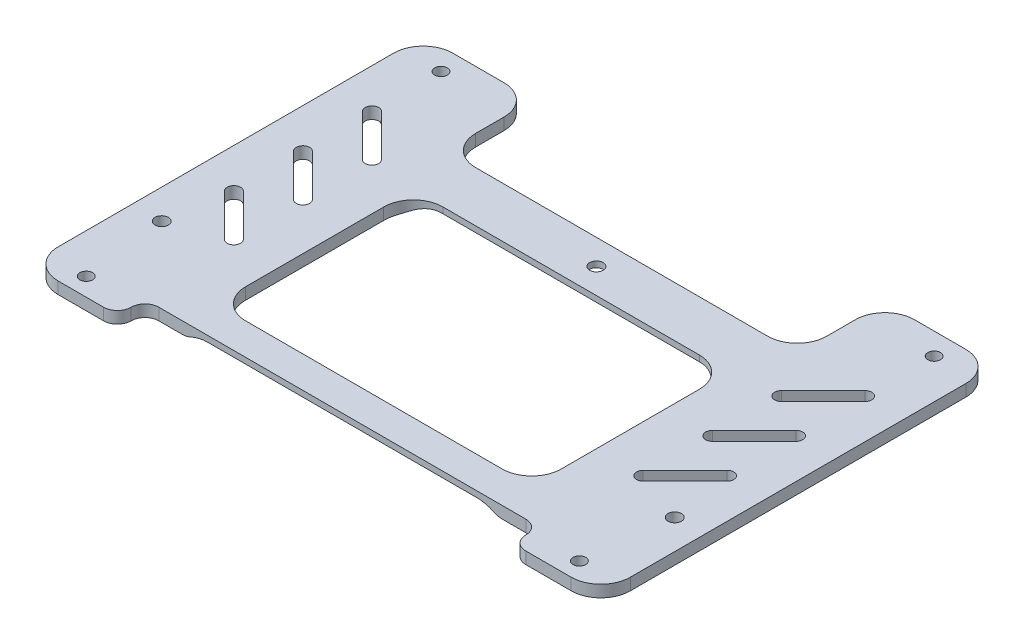
from build123d import *

# Parameters (mm, degrees)
SKETCH_1_R          = 1.7
EXTRUDE_1_DEPTH     = 3
FILLET_1_R          = 7.5
FILLET_2_R          = 3.5
CUT_EXTRUDE_5_DEPTH = 10
CUT_EXTRUDE_6_DEPTH = 10
CUT_EXTRUDE_7_DEPTH = 1.5
FILLET_START        = -35.28
FILLET_3_DEPTH      = 78.28
FILLET_4_R          = 10


with BuildPart() as part:
    # 草图1 → 凸台-拉伸1 (new body)
    with BuildSketch(Plane(origin=(0, 0, 0), x_dir=(1, 0, 0), z_dir=(0, 1, 0))):
        Polygon((-67.5, 50), (-44.5, 50), (-44.5, 27.78), (44.5, 27.78), (44.5, 50), (67.5, 50), (72.5, 50), (72.5, -50), (67.5, -50), (50, -50), (50, -43), (0, -43), (-50, -43), (-50, -50), (-67.5, -50), (-72.5, -50), (-72.5, 50), align=None)
        with Locations(Location((0, 21.39, 0), (0, 0, 270))):
            Circle(SKETCH_1_R, mode=Mode.SUBTRACT)
        with Locations(Location((65, -23.76, 0), (0, 0, 270))):
            Circle(SKETCH_1_R, mode=Mode.SUBTRACT)
        with Locations(Location((-65, -23.76, 0), (0, 0, 270))):
            Circle(SKETCH_1_R, mode=Mode.SUBTRACT)
        Polygon((-40, -10), (-40, -35), (40, -35), (40, 15), (-40, 15), align=None, mode=Mode.SUBTRACT)
    extrude(amount=EXTRUDE_1_DEPTH)

    # 圆角1
    fillet_1_edges = [part.edges().sort_by_distance(p)[0] for p in [
        (72.5, 1.5, -50),
        (72.5, 1.5, 50),
        (-72.5, 1.5, 50),
        (-72.5, 1.5, -50),
        (-44.5, 1.5, -50),
        (-44.5, 1.5, -27.78),
        (44.5, 1.5, -27.78),
        (44.5, 1.5, -50),
        (-40, 1.5, -15),
        (-40, 1.5, 35),
        (40, 1.5, 35),
        (40, 1.5, -15),
    ]]
    fillet(fillet_1_edges, radius=FILLET_1_R)

    # 圆角2
    fillet_2_edges = [part.edges().sort_by_distance(p)[0] for p in [
        (50, 1.5, 43),
        (-50, 1.5, 43),
    ]]
    fillet(fillet_2_edges, radius=FILLET_2_R)
    fillet_2_2_edges = [part.edges().sort_by_distance(p)[0] for p in [
        (50, 1.5, 50),
        (-50, 1.5, 50),
    ]]
    fillet(fillet_2_2_edges, radius=FILLET_2_R - 0.0001)  # a hair under: the kernel refuses the full size

    # 草图12 → 切除-拉伸5 (cut)
    with BuildSketch(Plane(origin=(0, 0, 0), x_dir=(-1, 0, 0), z_dir=(0, -1, 0))):
        with BuildLine():
            ThreePointArc((62.47765, -43.808317961), (61.34627915, -44.276947111), (60.87765, -45.408317961))
            Line((60.87765, -45.408317961), (62.47765, -45.408317961))
            Line((62.47765, -45.408317961), (62.47765, -43.808317961))
        make_face()
        with BuildLine():
            Line((62.47765, -45.408317961), (60.87765, -45.408317961))
            ThreePointArc((60.87765, -45.408317961), (62.47765, -47.008317961), (64.07765, -45.408317961))
            ThreePointArc((64.07765, -45.408317961), (63.60902085, -44.276947111), (62.47765, -43.808317961))
            Line((62.47765, -43.808317961), (62.47765, -45.408317961))
        make_face()
        with BuildLine():
            ThreePointArc((-62.47765, -43.808317961), (-63.60902085, -46.539688811), (-60.87765, -45.408317961))
            Line((-60.87765, -45.408317961), (-62.47765, -45.408317961))
            Line((-62.47765, -45.408317961), (-62.47765, -43.808317961))
        make_face()
        with BuildLine():
            Line((-62.47765, -45.408317961), (-60.87765, -45.408317961))
            ThreePointArc((-60.87765, -45.408317961), (-61.34627915, -44.276947111), (-62.47765, -43.808317961))
            Line((-62.47765, -43.808317961), (-62.47765, -45.408317961))
        make_face()
        with BuildLine():
            ThreePointArc((-62.47765, 42.891807039), (-61.34627915, 43.360436189), (-60.87765, 44.491807039))
            Line((-60.87765, 44.491807039), (-62.47765, 44.491807039))
            Line((-62.47765, 44.491807039), (-62.47765, 42.891807039))
        make_face()
        with BuildLine():
            Line((-62.47765, 44.491807039), (-60.87765, 44.491807039))
            ThreePointArc((-60.87765, 44.491807039), (-63.60902085, 45.623177889), (-62.47765, 42.891807039))
            Line((-62.47765, 42.891807039), (-62.47765, 44.491807039))
        make_face()
        with BuildLine():
            ThreePointArc((64.07765, 44.491807039), (62.47765, 46.091807039), (60.87765, 44.491807039))
            Line((60.87765, 44.491807039), (62.47765, 44.491807039))
            Line((62.47765, 44.491807039), (62.47765, 42.891807039))
            ThreePointArc((62.47765, 42.891807039), (63.60902085, 43.360436189), (64.07765, 44.491807039))
        make_face()
        with BuildLine():
            Line((62.47765, 44.491807039), (60.87765, 44.491807039))
            ThreePointArc((60.87765, 44.491807039), (61.34627915, 43.360436189), (62.47765, 42.891807039))
            Line((62.47765, 42.891807039), (62.47765, 44.491807039))
        make_face()
    extrude(amount=-CUT_EXTRUDE_5_DEPTH, mode=Mode.SUBTRACT)

    # 草图13 → 切除-拉伸6 (cut)
    with BuildSketch(Plane(origin=(0, 3, 0), x_dir=(1, 0, 0), z_dir=(0, 1, 0))):
        with BuildLine():
            Line((61.275568472, -6.806111433), (50.668966754, -17.412713151))
            ThreePointArc((50.668966754, -17.412713151), (50.668966754, -19.816876207), (53.07312981, -19.816876207))
            Line((53.07312981, -19.816876207), (63.679731528, -9.210274489))
            ThreePointArc((63.679731528, -9.210274489), (63.679731528, -6.806111433), (61.275568472, -6.806111433))
        make_face()
        with BuildLine():
            Line((-61.275568472, 28.193888567), (-50.668966754, 17.587286849))
            ThreePointArc((-50.668966754, 17.587286849), (-50.668966754, 15.183123793), (-53.07312981, 15.183123793))
            Line((-53.07312981, 15.183123793), (-63.679731528, 25.789725511))
            ThreePointArc((-63.679731528, 25.789725511), (-63.679731528, 28.193888567), (-61.275568472, 28.193888567))
        make_face()
        with BuildLine():
            Line((-63.679731528, 8.289725511), (-53.07312981, -2.316876207))
            ThreePointArc((-53.07312981, -2.316876207), (-50.668966754, -2.316876207), (-50.668966754, 0.087286849))
            Line((-50.668966754, 0.087286849), (-61.275568472, 10.693888567))
            ThreePointArc((-61.275568472, 10.693888567), (-63.679731528, 10.693888567), (-63.679731528, 8.289725511))
        make_face()
        with BuildLine():
            Line((-63.679731528, -9.210274489), (-53.07312981, -19.816876207))
            ThreePointArc((-53.07312981, -19.816876207), (-50.668966754, -19.816876207), (-50.668966754, -17.412713151))
            Line((-50.668966754, -17.412713151), (-61.275568472, -6.806111433))
            ThreePointArc((-61.275568472, -6.806111433), (-63.679731528, -6.806111433), (-63.679731528, -9.210274489))
        make_face()
        with BuildLine():
            Line((61.275568472, 10.693888567), (50.668966754, 0.087286849))
            ThreePointArc((50.668966754, 0.087286849), (50.668966754, -2.316876207), (53.07312981, -2.316876207))
            Line((53.07312981, -2.316876207), (63.679731528, 8.289725511))
            ThreePointArc((63.679731528, 8.289725511), (63.679731528, 10.693888567), (61.275568472, 10.693888567))
        make_face()
        with BuildLine():
            Line((61.275568472, 28.193888567), (50.668966754, 17.587286849))
            ThreePointArc((50.668966754, 17.587286849), (50.668966754, 15.183123793), (53.07312981, 15.183123793))
            Line((53.07312981, 15.183123793), (63.679731528, 25.789725511))
            ThreePointArc((63.679731528, 25.789725511), (63.679731528, 28.193888567), (61.275568472, 28.193888567))
        make_face()
    extrude(amount=-CUT_EXTRUDE_6_DEPTH, mode=Mode.SUBTRACT)

    # 草图14 → 切除-拉伸7 (cut)
    with BuildSketch(Plane.XZ):
        Polygon((-37, 27.78), (-37, 43), (37, 43), (37, 27.78), (37, -27.78), (-37, -27.78), align=None)
    extrude(amount=-CUT_EXTRUDE_7_DEPTH, mode=Mode.SUBTRACT)

    # 圆角3: read off the stored shape, not the designer's step
    # 圆角3 outline → 圆角3 (cut)
    with BuildSketch(Plane.XY.offset(FILLET_START)):
        with BuildLine():
            Line((-40.570714214, 0), (-37, 0))
            Line((-37, 0), (-37, 1.5))
            ThreePointArc((-37, 1.5), (-38.634222541, 0.390227771), (-40.570714214, 0))
        make_face()
        with BuildLine():
            ThreePointArc((40.570714214, 0), (38.634222541, 0.390227771), (37, 1.5))
            Line((37, 1.5), (37, 0))
            Line((37, 0), (40.570714214, 0))
        make_face()
    extrude(amount=FILLET_3_DEPTH, mode=Mode.SUBTRACT)

    # 圆角4
    fillet_4_edges = [part.edges().sort_by_distance(p)[0] for p in [
        (-37, 1.5, 38.25),
        (-37, 1.5, -20.64),
        (37, 1.5, 38.25),
        (37, 1.5, -20.64),
    ]]
    fillet(fillet_4_edges, radius=FILLET_4_R)


solid = part.part
